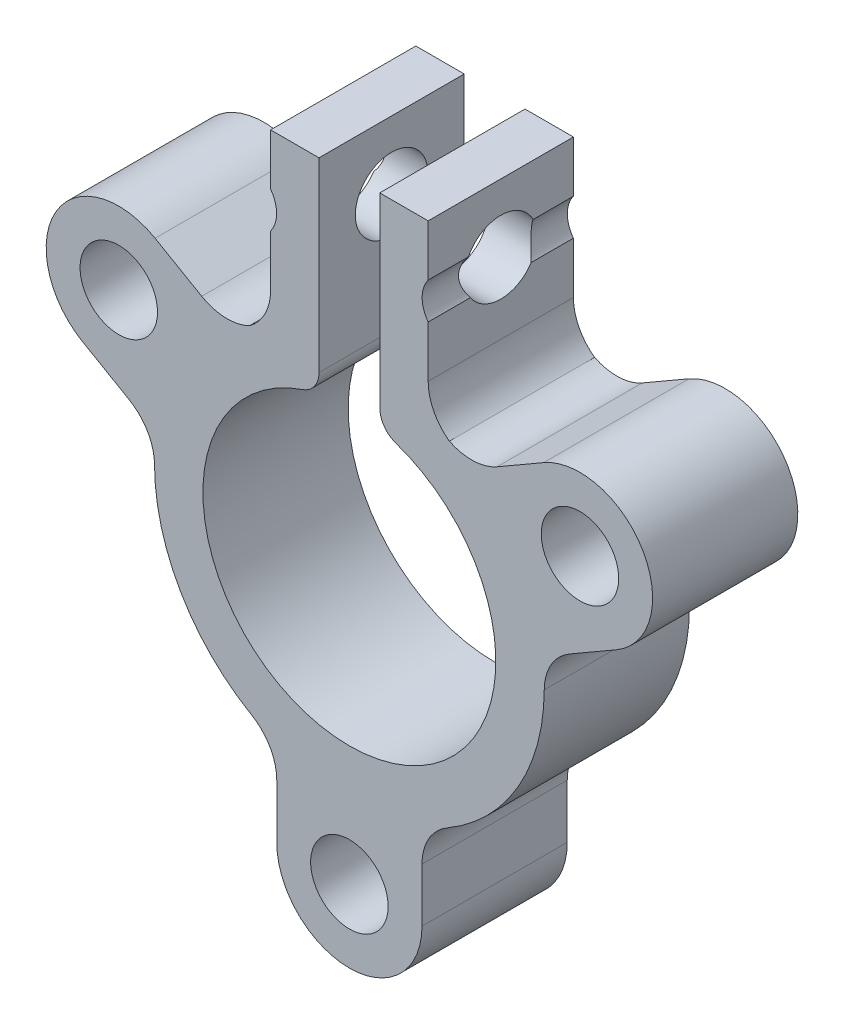
from build123d import *

# Parameters (mm, degrees)
EXTRUDE_1_DEPTH     = 6
SKETCH_2_R          = 1.5
CUT_EXTRUDE_1_DEPTH = 20.23763281
SKETCH_3_R          = 1.6
EXTRUDE_2_DEPTH     = 6
FILLET_1_R          = 2.1
FILLET_2_R          = 1
SKETCH_4_R          = 1.25
CUT_EXTRUDE_2_DEPTH = 20.979768962


with BuildPart() as part:
    # ｽｹｯﾁ1 → ﾎﾞｽ - 押し出し1 (new body)
    with BuildSketch(Plane.XY):
        with BuildLine():
            Line((-1.255, 5.918401389), (-1.255, 14.36257258))
            Line((-1.255, 14.36257258), (-3.255, 14.36257258))
            Line((-3.255, 14.36257258), (-3.255, 7.36257258))
            ThreePointArc((-3.255, 7.36257258), (0, -8.05), (3.255, 7.36257258))
            Line((3.255, 7.36257258), (3.255, 14.36257258))
            Line((3.255, 14.36257258), (1.255, 14.36257258))
            Line((1.255, 14.36257258), (1.255, 5.918401389))
            ThreePointArc((1.255, 5.918401389), (0, -6.05), (-1.255, 5.918401389))
        make_face()
    extrude(amount=EXTRUDE_1_DEPTH)

    # ｽｹｯﾁ2 → ｶｯﾄ - 押し出し1 (cut, through all)
    with BuildSketch(Plane(origin=(3.255, 0, 0), x_dir=(0, 0, -1), z_dir=(1, 0, 0))):
        with Locations(Location((-3, 11.56257258, 0), (0, 0, 90))):
            Circle(SKETCH_2_R)
    extrude(amount=-CUT_EXTRUDE_1_DEPTH, mode=Mode.SUBTRACT)

    # ｽｹｯﾁ3 → ﾎﾞｽ - 押し出し2 (add, through all)
    # profile 1 of 3: a face of its own
    with BuildSketch(Plane.XY.offset(6)):
        with BuildLine():
            Line((-4.969302513, 6.333129758), (-8.026279442, 8.098076211))
            ThreePointArc((-8.026279442, 8.098076211), (-12.124355653, 7), (-11.026279442, 2.901923789))
            Line((-11.026279442, 2.901923789), (-7.969302513, 1.136977336))
            ThreePointArc((-7.969302513, 1.136977336), (-6.9715045, 4.025), (-4.969302513, 6.333129758))
        make_face()
        with Locations((-9.526279442, 5.5)):
            Circle(SKETCH_3_R, mode=Mode.SUBTRACT)
    # profile 2 of 3: a face of its own
    with BuildSketch(Plane.XY.offset(6)):
        with BuildLine():
            Line((8.026279442, 8.098076211), (4.969302513, 6.333129758))
            ThreePointArc((4.969302513, 6.333129758), (6.9715045, 4.025), (7.969302513, 1.136977336))
            Line((7.969302513, 1.136977336), (11.026279442, 2.901923789))
            ThreePointArc((11.026279442, 2.901923789), (12.124355653, 7), (8.026279442, 8.098076211))
        make_face()
        with Locations((9.526279442, 5.5)):
            Circle(SKETCH_3_R, mode=Mode.SUBTRACT)
    # profile 3 of 3: a face of its own
    with BuildSketch(Plane.XY.offset(6)):
        with BuildLine():
            Line((3, -11), (3, -7.470107094))
            ThreePointArc((3, -7.470107094), (0, -8.05), (-3, -7.470107094))
            Line((-3, -7.470107094), (-3, -11))
            ThreePointArc((-3, -11), (0, -14), (3, -11))
        make_face()
        with Locations((0, -11)):
            Circle(SKETCH_3_R, mode=Mode.SUBTRACT)
    extrude(amount=-EXTRUDE_2_DEPTH)

    # ﾌｨﾚｯﾄ1
    # the kernel refuses this fillet: 2.1 mm, written as the material it adds along each edge
    with BuildSketch(Plane(origin=(3.255, 7.36257258, 0), x_dir=(0.8842030952275957, -0.46710265080594376, 0), z_dir=(0, 0, 1))) as fillet_1_piece_1:
        with BuildLine():
            CenterArc((1.268338995, 2.094894415), FILLET_1_R, 207.846387093, 58.157490839)
            Line((-0.588487505, 1.113978849), (0, 0))
            ThreePointArc((0, 0), (0.560996094, 0.019571407), (1.121992188, 0))
        make_face()
    extrude(amount=6)
    with BuildSketch(Plane(origin=(-3.255, 7.36257258, 0), x_dir=(0, 1, 0), z_dir=(0, 0, 1))) as fillet_1_piece_2:
        with BuildLine():
            CenterArc((1.25986762, 2.1), FILLET_1_R, 211.842509161, 58.157490839)
            ThreePointArc((-0.524085525, 0.992068966), (-0.244737664, 0.505176339), (0, 0))
            Line((0, 0), (1.25986762, 0))
        make_face()
    extrude(amount=6)
    with BuildSketch(Plane(origin=(-4.969302513, 6.333129758, 6), x_dir=(0.8292498658950391, 0.5588780367066322, 0), z_dir=(0, 0, -1)), Plane(origin=(7.969302513, 1.136977336, 6), x_dir=(0.06937764445759169, -0.9975904683032591, 0), z_dir=(0, 0, -1)), Plane(origin=(-3, -7.470107094, 6), x_dir=(-0.8986275103526323, 0.4387124315966321, 0), z_dir=(0, 0, -1))) as fillet_1_piece_3:
        with BuildLine():
            CenterArc((1.314348194, -2.094516792), FILLET_1_R, 94.141330549, 59.836911418)
            Line((-0.572769578, -1.173220685), (0, 0))
            ThreePointArc((0, 0), (0.581346317, -0.021018965), (1.162692633, 0))
        make_face()
    extrude(amount=6)
    with BuildSketch(Plane(origin=(-7.969302513, 1.136977336, 6), x_dir=(-0.06937764445760207, -0.9975904683032585, 0), z_dir=(0, 0, -1)), Plane(origin=(4.969302513, 6.333129758, 6), x_dir=(-0.8292498658950355, 0.5588780367066375, 0), z_dir=(0, 0, -1)), Plane(origin=(3, -7.470107094, 6), x_dir=(0.8986275103526384, 0.43871243159661977, 0), z_dir=(0, 0, -1))) as fillet_1_piece_4:
        with BuildLine():
            CenterArc((1.314348194, 2.094516792), FILLET_1_R, 206.021758033, 59.836911418)
            Line((-0.572769578, 1.173220685), (0, 0))
            ThreePointArc((0, 0), (0.581346317, 0.021018965), (1.162692633, 0))
        make_face()
    extrude(amount=6)

    # ﾌｨﾚｯﾄ2
    fillet_2_edges = [part.edges().sort_by_distance(p)[0] for p in [
        (1.255, 5.918401389, 3),
        (-1.255, 5.918401389, 3),
    ]]
    fillet(fillet_2_edges, radius=FILLET_2_R)

    # ｽｹｯﾁ4 → ｶｯﾄ - 押し出し2 (cut, through all)
    with BuildSketch(Plane.XY.offset(6)):
        with Locations((4.255, 11.49250639)):
            Circle(SKETCH_4_R)
        with Locations((-4.255, 11.49250639)):
            Circle(SKETCH_4_R)
    extrude(amount=-CUT_EXTRUDE_2_DEPTH, mode=Mode.SUBTRACT)


solid = part.part
